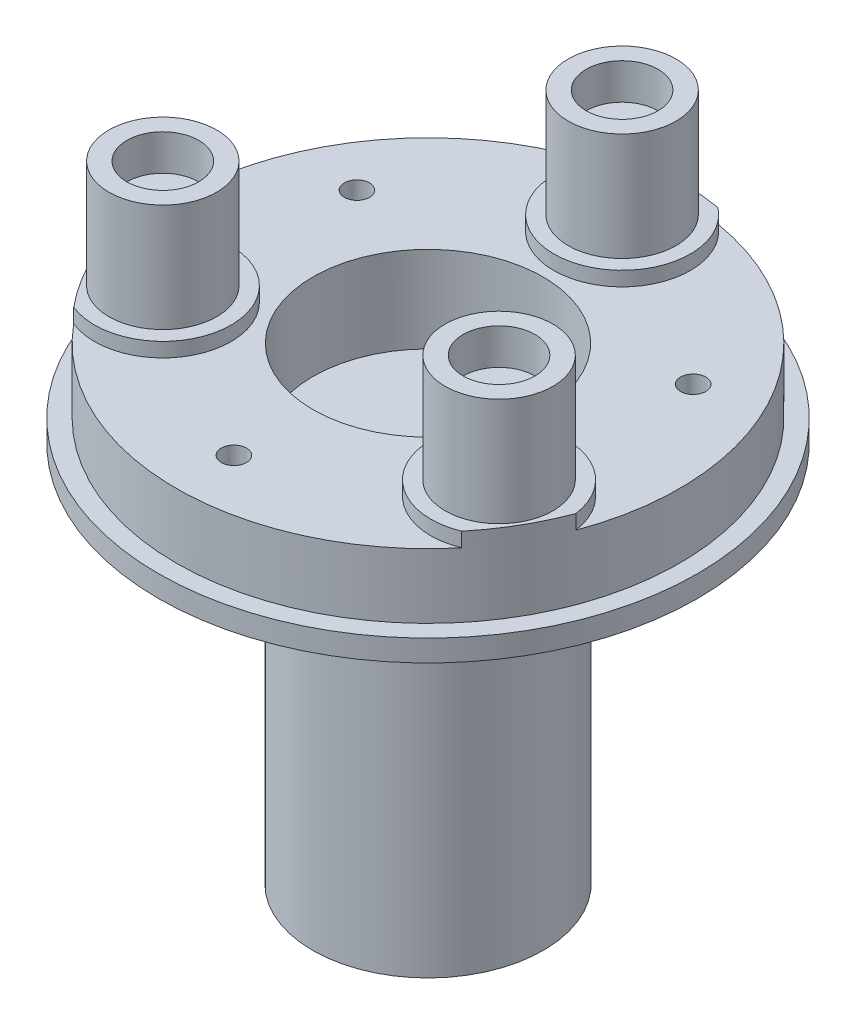
from build123d import *

# Parameters (mm, degrees)
SKETCH1_R                                     = 37.5
BOSS_EXTRUDE1_DEPTH                           = 3
SKETCH1_3_R                                   = 35
BOSS_EXTRUDE2_DEPTH                           = 12
SKETCH13_R                                    = 16
CUT_EXTRUDE6_DEPTH                            = 55.373706881
BOSS_EXTRUDE9_DEPTH                           = 2
SKETCH25_R                                    = 7.5
BOSS_EXTRUDE10_DEPTH                          = 15
SKETCH26_R                                    = 5
CUT_EXTRUDE9_DEPTH                            = 5
CBORE_FOR_M3_PAN_HEAD_MACHINE_SCREW1_AT_COUNT = 2
CBORE_FOR_M3_PAN_HEAD_MACHINE_SCREW1_AT_PITCH = 46.765371804
CBORE_FOR_M3_PAN_HEAD_MACHINE_SCREW1_2_COUNT  = 2
CBORE_FOR_M3_PAN_HEAD_MACHINE_SCREW1_2_PITCH  = 46.765371804
SKETCH29_R                                    = 1.75
CUT_EXTRUDE10_DEPTH                           = 56.691112397
SKETCH31_R                                    = 16.05
BOSS_EXTRUDE11_DEPTH                          = 53.11
SKETCH32_R                                    = 18
SKETCH32_R_2                                  = 16
BOSS_EXTRUDE12_DEPTH                          = 1.11


with BuildPart() as part:
    # Sketch1 → Boss-Extrude1 (new body)
    with BuildSketch(Plane(origin=(0, 0, 0), x_dir=(1, 0, 0), z_dir=(0, 1, 0))):
        Circle(SKETCH1_R)
    extrude(amount=BOSS_EXTRUDE1_DEPTH)

    # Sketch1<3> → Boss-Extrude2 (add)
    with BuildSketch(Plane(origin=(0, 0, 0), x_dir=(1, 0, 0), z_dir=(0, 1, 0))):
        Circle(SKETCH1_3_R)
    extrude(amount=BOSS_EXTRUDE2_DEPTH)

    # Sketch13 → Cut-Extrude6 (cut, through all)
    with BuildSketch(Plane(origin=(0, 12, 0), x_dir=(1, 0, 0), z_dir=(0, 1, 0))):
        Circle(SKETCH13_R)
    extrude(amount=-CUT_EXTRUDE6_DEPTH, mode=Mode.SUBTRACT)

    # Sketch24 → Boss-Extrude9 (add)
    with BuildSketch(Plane(origin=(0, 12, 0), x_dir=(1, 0, 0), z_dir=(0, 1, 0))):
        with BuildLine():
            ThreePointArc((5.813043417, 34.513888889), (0, 35), (-5.813043417, 34.513888889))
            ThreePointArc((-5.813043417, 34.513888889), (0, 17.5), (5.813043417, 34.513888889))
        make_face()
        with BuildLine():
            ThreePointArc((-26.983382853, -22.291187717), (-15.155444566, -8.75), (-32.79642627, -12.222701172))
            ThreePointArc((-32.79642627, -12.222701172), (-30.310889132, -17.5), (-26.983382853, -22.291187717))
        make_face()
        with BuildLine():
            ThreePointArc((26.983382853, -22.291187717), (30.310889132, -17.5), (32.79642627, -12.222701172))
            ThreePointArc((32.79642627, -12.222701172), (15.155444566, -8.75), (26.983382853, -22.291187717))
        make_face()
    extrude(amount=BOSS_EXTRUDE9_DEPTH)

    # Sketch25 → Boss-Extrude10 (add)
    with BuildSketch(Plane(origin=(0, 14, 0), x_dir=(1, 0, 0), z_dir=(0, 1, 0))):
        with Locations((0, 27)):
            Circle(SKETCH25_R)
        with Locations((23.382685902, -13.5)):
            Circle(SKETCH25_R)
        with Locations((-23.382685902, -13.5)):
            Circle(SKETCH25_R)
    extrude(amount=BOSS_EXTRUDE10_DEPTH)

    # Sketch26 → Cut-Extrude9 (cut)
    with BuildSketch(Plane(origin=(0, 29, 0), x_dir=(1, 0, 0), z_dir=(0, 1, 0))):
        with Locations((0, 27)):
            Circle(SKETCH26_R)
        with Locations((23.382685902, -13.5)):
            Circle(SKETCH26_R)
        with Locations((-23.382685902, -13.5)):
            Circle(SKETCH26_R)
    extrude(amount=-CUT_EXTRUDE9_DEPTH, mode=Mode.SUBTRACT)

    # Sketch28 → CBORE for M3 Pan Head Machine Screw1 (revolve, cut)
    with BuildSketch(Plane(origin=(0, 0, -27), x_dir=(0, 0, -1), z_dir=(1, 0, 0))):
        Polygon((0, 0), (0, 29), (1.8, 29), (1.8, 2.4), (3.5, 2.4), (3.5, 0.025), (3.525, 0), align=None)
    cbore_for_m3_pan_head_machine_screw1 = revolve(axis=Axis((0, -6.35, -27), (0, 1, 0)), mode=Mode.SUBTRACT)

    # CBORE for M3 Pan Head Machine Screw1 at: CBORE for M3 Pan Head Machine Screw1 ×2
    with Locations(*[Vector(-0.5000000000000369, 0, 0.8660254037844174) * (i * CBORE_FOR_M3_PAN_HEAD_MACHINE_SCREW1_AT_PITCH) for i in range(1, CBORE_FOR_M3_PAN_HEAD_MACHINE_SCREW1_AT_COUNT)]):
        add(cbore_for_m3_pan_head_machine_screw1, mode=Mode.SUBTRACT)

    # CBORE for M3 Pan Head Machine Screw1 2: CBORE for M3 Pan Head Machine Screw1 ×2
    with Locations(*[Vector(0.49999999999996353, 0, 0.8660254037844598) * (i * CBORE_FOR_M3_PAN_HEAD_MACHINE_SCREW1_2_PITCH) for i in range(1, CBORE_FOR_M3_PAN_HEAD_MACHINE_SCREW1_2_COUNT)]):
        add(cbore_for_m3_pan_head_machine_screw1, mode=Mode.SUBTRACT)

    # Sketch29 → Cut-Extrude10 (cut, through all)
    with BuildSketch(Plane(origin=(0, 12, 0), x_dir=(1, 0, 0), z_dir=(0, 1, 0))):
        with Locations((23.382685902, 13.5)):
            Circle(SKETCH29_R)
        with Locations((0, -27)):
            Circle(SKETCH29_R)
        with Locations((-23.382685902, 13.5)):
            Circle(SKETCH29_R)
    extrude(amount=-CUT_EXTRUDE10_DEPTH, mode=Mode.SUBTRACT)



with BuildPart() as body_2:
    # Sketch31 → Boss-Extrude11 (new body)
    with BuildSketch(Plane.XZ):
        Circle(SKETCH31_R)
    extrude(amount=BOSS_EXTRUDE11_DEPTH)


with BuildPart() as part_1:
    add(part.part)

    add(body_2.part)  # Boss-Extrude12 merges body 2
    # Sketch32 → Boss-Extrude12 (add)
    with BuildSketch(Plane.XZ):
        Circle(SKETCH32_R)
        Circle(SKETCH32_R_2, mode=Mode.SUBTRACT)
    extrude(amount=BOSS_EXTRUDE12_DEPTH)


solid = part_1.part
